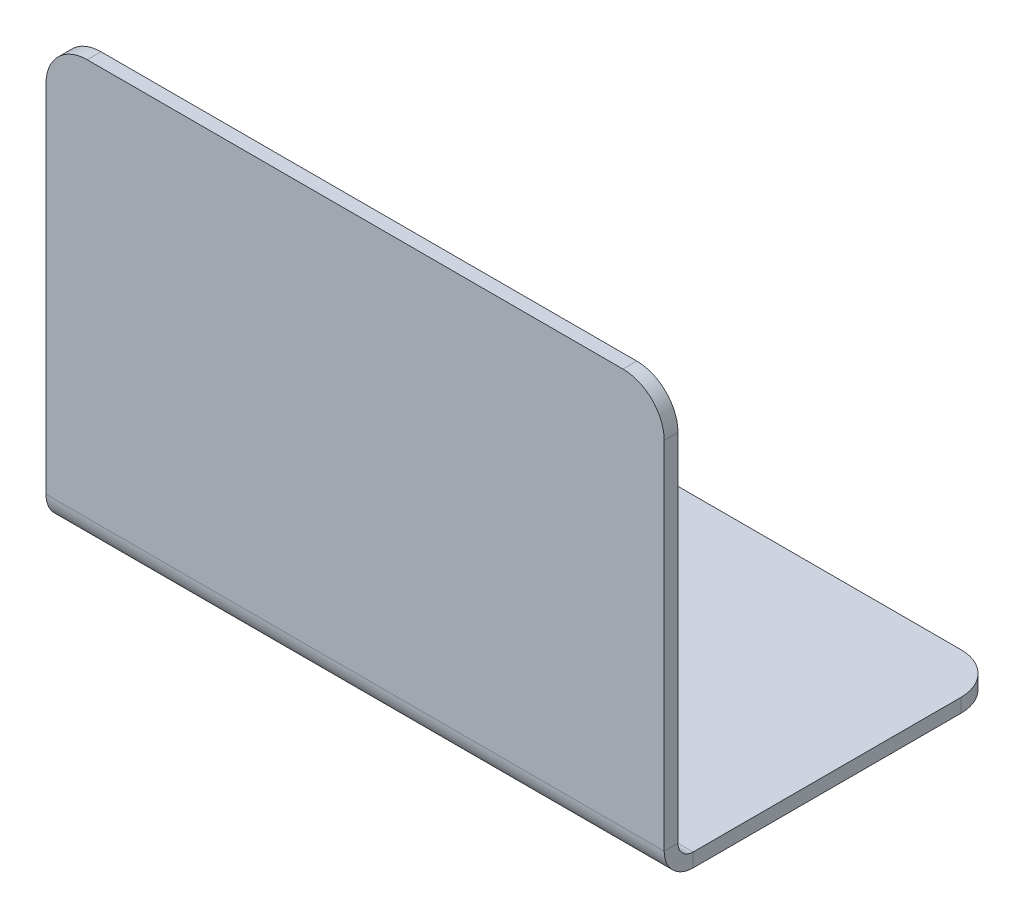
from build123d import *

# Parameters (mm, degrees)
SKETCH1_W          = 30
SKETCH1_H          = 15
BASE_FLANGE1_DEPTH = 0.67
EDGE_FLANGE1_DEPTH = 30
SKETCH7_R          = 1.7
CUT_EXTRUDE1_DEPTH = 10
FILLET1_R          = 2


# Sheet-metal steps are written as plain solids
with BuildPart() as part:
    # Sketch1 → Base-Flange1 (new body)
    with BuildSketch(Plane(origin=(0, 0, 0), x_dir=(1, 0, 0), z_dir=(0, 1, 0))):
        with Locations((15, -7.5)):
            Rectangle(SKETCH1_W, SKETCH1_H)
    extrude(amount=-BASE_FLANGE1_DEPTH)

    # Edge-Flange1 section (across the edge) → Edge-Flange1 (add)
    with BuildSketch(Plane(origin=(0, 0, 15.7366), x_dir=(0, 0, -1), z_dir=(1, 0, 0))):
        with BuildLine():
            Line((-0.67, 0.7366), (-0.67, 20))
            Line((-0.67, 20), (0, 20))
            Line((0, 20), (0, 0.7366))
            ThreePointArc((0, 0.7366), (0.215745145, 0.215745145), (0.7366, 0))
            Line((0.7366, 0), (0.7366, -0.67))
            ThreePointArc((0.7366, -0.67), (-0.258016398, -0.258016398), (-0.67, 0.7366))
        make_face()
    extrude(amount=EDGE_FLANGE1_DEPTH)

    # Sketch7 → Cut-Extrude1 (cut)
    with BuildSketch(Plane(origin=(0, 0, 0), x_dir=(1, 0, 0), z_dir=(0, 1, 0))):
        with Locations(Location((15, -7.9066, 0), (0, 0, 270))):
            Circle(SKETCH7_R)
    extrude(amount=-CUT_EXTRUDE1_DEPTH, mode=Mode.SUBTRACT)

    # Fillet1
    fillet1_edges = [part.edges().sort_by_distance(p)[0] for p in [
        (0, 20, 16.0716),
        (30, 20, 16.0716),
        (0, -0.335, 0),
        (30, -0.335, 0),
    ]]
    fillet(fillet1_edges, radius=FILLET1_R)


solid = part.part
